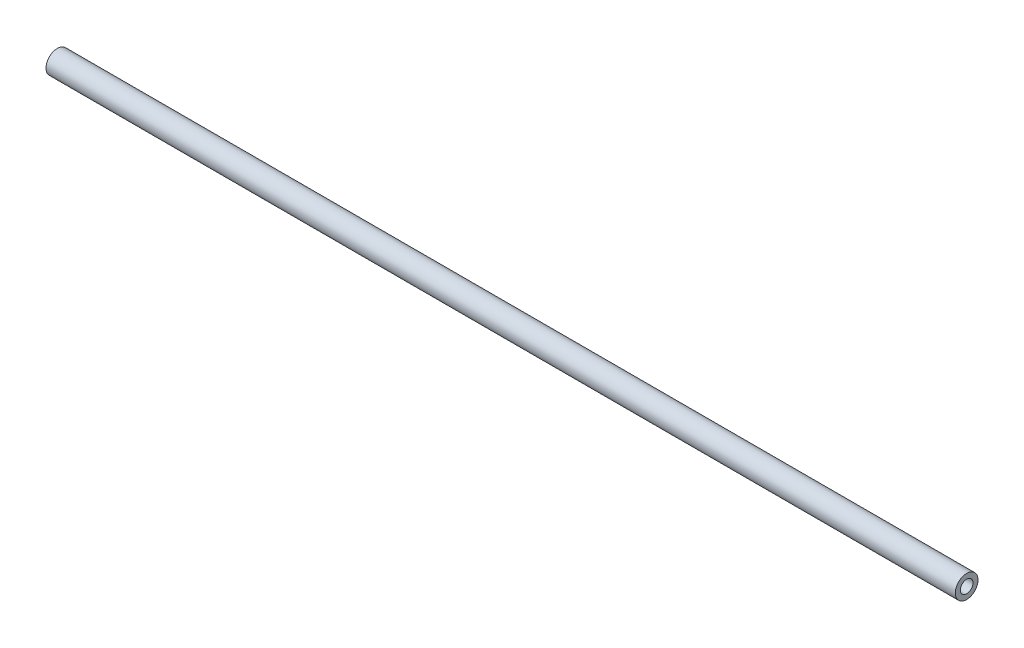
from build123d import *

# Parameters (mm, degrees)
SKETCH1_R           = 1.125
SKETCH1_R_2         = 0.625
BOSS_EXTRUDE1_DEPTH = 90


with BuildPart() as part:
    # Sketch1 → Boss-Extrude1 (new body)
    with BuildSketch(Plane(origin=(0, 0, 0), x_dir=(0, 0, -1), z_dir=(1, 0, 0))):
        Circle(SKETCH1_R)
        Circle(SKETCH1_R_2, mode=Mode.SUBTRACT)
    extrude(amount=BOSS_EXTRUDE1_DEPTH)


solid = part.part
